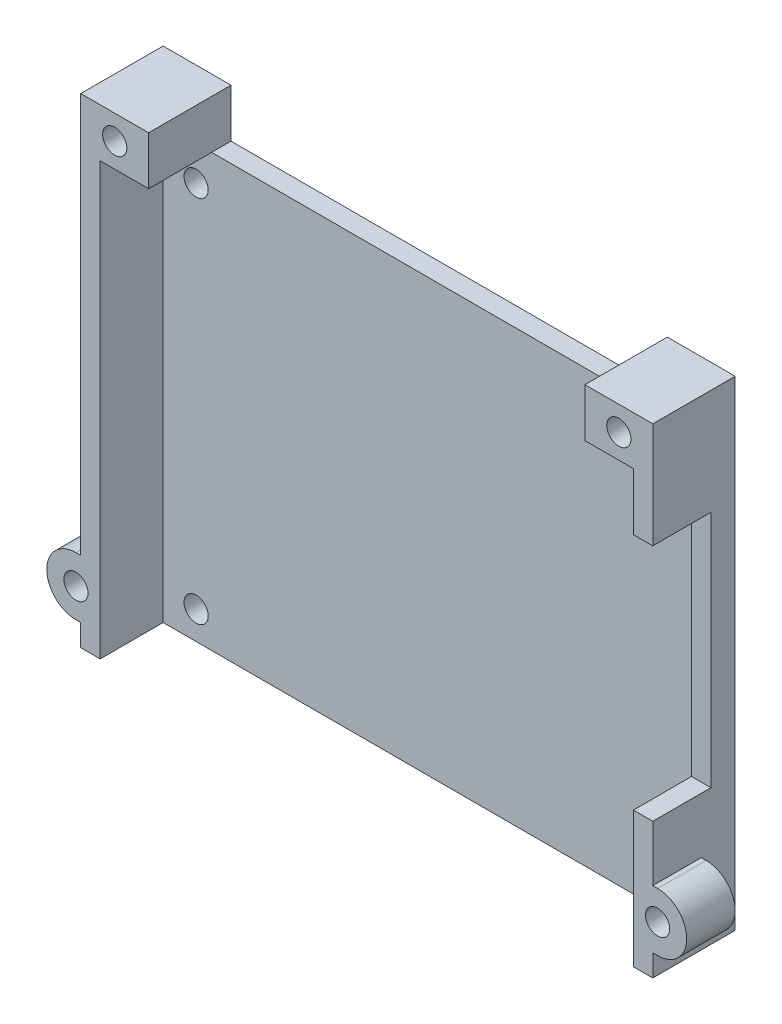
from build123d import *

# Parameters (mm, degrees)
BOSS_EXTRUDE1_DEPTH = 44.5
SKETCH2_W           = 6
SKETCH2_H           = 24.6
CUT_EXTRUDE1_DEPTH  = 10
BOSS_EXTRUDE2_DEPTH = 8.5
CUT_EXTRUDE2_DEPTH  = 11
SKETCH4_W           = 7
SKETCH4_H           = 8.5
BOSS_EXTRUDE3_DEPTH = 5
SKETCH5_R           = 1.25
CUT_EXTRUDE3_DEPTH  = 81.179486155
SKETCH7_R           = 1.25
CUT_EXTRUDE4_DEPTH  = 10
CUT_EXTRUDE6_DEPTH  = 3.5
BOSS_EXTRUDE4_DEPTH = 3


with BuildPart() as part:
    # Sketch1 → Boss-Extrude1 (new body)
    with BuildSketch(Plane(origin=(0, 0, 0), x_dir=(1, 0, 0), z_dir=(0, 1, 0))):
        Polygon((0, 0), (2, 0), (2, 6.5), (57, 6.5), (57, 0), (59, 0), (59, 8.5), (0, 8.5), align=None)
    extrude(amount=BOSS_EXTRUDE1_DEPTH)

    # Sketch2 → Cut-Extrude1 (cut)
    with BuildSketch(Plane(origin=(59, 0, 0), x_dir=(0, 0, -1), z_dir=(1, 0, 0))):
        with Locations((3, 26.3)):
            Rectangle(SKETCH2_W, SKETCH2_H)
    extrude(amount=-CUT_EXTRUDE1_DEPTH, mode=Mode.SUBTRACT)

    # Sketch3 → Boss-Extrude2 (add)
    with BuildSketch(Plane(origin=(0, 0, -8.5), x_dir=(-1, 0, 0), z_dir=(0, 0, -1))):
        with BuildLine():
            Line((-59, 6.395643924), (-59, 8.25))
            Line((-59, 8.25), (-59.5, 8.25))
            ThreePointArc((-59.5, 8.25), (-62.5, 5.25), (-59.5, 2.25))
            Line((-59.5, 2.25), (-59, 2.25))
            Line((-59, 2.25), (-59, 4.104356076))
            ThreePointArc((-59, 4.104356076), (-60.75, 5.25), (-59, 6.395643924))
        make_face()
        with BuildLine():
            Line((0.5, 8.25), (0, 8.25))
            Line((0, 8.25), (0, 6.395643924))
            ThreePointArc((0, 6.395643924), (1.75, 5.25), (0, 4.104356076))
            Line((0, 4.104356076), (0, 2.25))
            Line((0, 2.25), (0.5, 2.25))
            ThreePointArc((0.5, 2.25), (3.5, 5.25), (0.5, 8.25))
        make_face()
    extrude(amount=-BOSS_EXTRUDE2_DEPTH)

    # Sketch3<3> → Cut-Extrude2 (cut)
    with BuildSketch(Plane(origin=(0, 0, -8.5), x_dir=(-1, 0, 0), z_dir=(0, 0, -1))):
        with BuildLine():
            ThreePointArc((-59, 4.104356076), (-58.25, 5.25), (-59, 6.395643924))
            Line((-59, 6.395643924), (-59, 4.104356076))
        make_face()
        with BuildLine():
            Line((0, 4.104356076), (0, 6.395643924))
            ThreePointArc((0, 6.395643924), (-0.75, 5.25), (0, 4.104356076))
        make_face()
    extrude(amount=-CUT_EXTRUDE2_DEPTH, mode=Mode.SUBTRACT)

    # Sketch4 → Boss-Extrude3 (add)
    with BuildSketch(Plane(origin=(0, 44.5, 0), x_dir=(1, 0, 0), z_dir=(0, 1, 0))):
        with Locations((3.5, 4.25)):
            Rectangle(SKETCH4_W, SKETCH4_H)
        with Locations((55.5, 4.25)):
            Rectangle(SKETCH4_W, SKETCH4_H)
    extrude(amount=BOSS_EXTRUDE3_DEPTH)

    # Sketch5 → Cut-Extrude3 (cut, through all)
    with BuildSketch(Plane(origin=(0, 0, -8.5), x_dir=(-1, 0, 0), z_dir=(0, 0, -1))):
        with Locations((-55.5, 47)):
            Circle(SKETCH5_R)
        with Locations((-3.5, 47)):
            Circle(SKETCH5_R)
    extrude(amount=-CUT_EXTRUDE3_DEPTH, mode=Mode.SUBTRACT)

    # Sketch7 → Cut-Extrude4 (cut)
    with BuildSketch(Plane(origin=(0, 0, -8.5), x_dir=(-1, 0, 0), z_dir=(0, 0, -1))):
        with Locations((-5.4, 2.9)):
            Circle(SKETCH7_R)
        with Locations((-53.6, 2.9)):
            Circle(SKETCH7_R)
        with Locations((-53.6, 40.95)):
            Circle(SKETCH7_R)
        with Locations((-5.4, 40.95)):
            Circle(SKETCH7_R)
    extrude(amount=-CUT_EXTRUDE4_DEPTH, mode=Mode.SUBTRACT)

    # Sketch3<4> → Cut-Extrude6 (cut)
    with BuildSketch(Plane(origin=(0, 0, -8.5), x_dir=(-1, 0, 0), z_dir=(0, 0, -1))):
        with BuildLine():
            Line((-59, 6.395643924), (-59, 8.25))
            Line((-59, 8.25), (-59.5, 8.25))
            ThreePointArc((-59.5, 8.25), (-62.5, 5.25), (-59.5, 2.25))
            Line((-59.5, 2.25), (-59, 2.25))
            Line((-59, 2.25), (-59, 4.104356076))
            ThreePointArc((-59, 4.104356076), (-60.75, 5.25), (-59, 6.395643924))
        make_face()
        with BuildLine():
            Line((0.5, 8.25), (0, 8.25))
            Line((0, 8.25), (0, 6.395643924))
            ThreePointArc((0, 6.395643924), (1.75, 5.25), (0, 4.104356076))
            Line((0, 4.104356076), (0, 2.25))
            Line((0, 2.25), (0.5, 2.25))
            ThreePointArc((0.5, 2.25), (3.5, 5.25), (0.5, 8.25))
        make_face()
    extrude(amount=-CUT_EXTRUDE6_DEPTH, mode=Mode.SUBTRACT)

    # Sketch3<5> → Boss-Extrude4 (add)
    with BuildSketch(Plane(origin=(0, 0, -8.5), x_dir=(-1, 0, 0), z_dir=(0, 0, -1))):
        with BuildLine():
            ThreePointArc((-59, 4.104356076), (-58.25, 5.25), (-59, 6.395643924))
            Line((-59, 6.395643924), (-59, 4.104356076))
        make_face()
        with BuildLine():
            Line((0, 4.104356076), (0, 6.395643924))
            ThreePointArc((0, 6.395643924), (-0.75, 5.25), (0, 4.104356076))
        make_face()
    extrude(amount=-BOSS_EXTRUDE4_DEPTH)


solid = part.part
